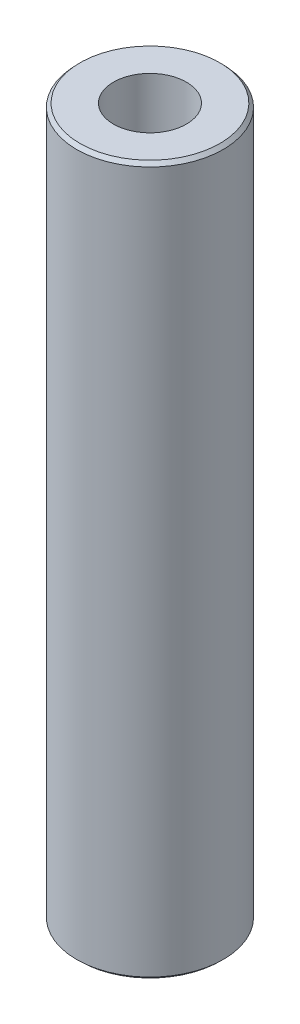
from build123d import *
from OCP.BRepFilletAPI import BRepFilletAPI_MakeChamfer

# Parameters (mm, degrees)
SKETCH1_R           = 60
BOSS_EXTRUDE1_DEPTH = 580.026093204
SKETCH2_R           = 29.843052905
CUT_EXTRUDE1_DEPTH  = 587.199853973
CHAMFER1_SIZE       = 2.90600484
CHAMFER1_SIZE2      = 2.715987347


with BuildPart() as part:
    # Sketch1 → Boss-Extrude1 (new body)
    with BuildSketch(Plane(origin=(0, 0, 0), x_dir=(1, 0, 0), z_dir=(0, 1, 0))):
        Circle(SKETCH1_R)
    extrude(amount=BOSS_EXTRUDE1_DEPTH)

    # Sketch2 → Cut-Extrude1 (cut, through all)
    with BuildSketch(Plane(origin=(0, 0, 0), x_dir=(1, 0, 0), z_dir=(0, 1, 0))):
        Circle(SKETCH2_R)
    extrude(amount=CUT_EXTRUDE1_DEPTH, mode=Mode.SUBTRACT)

    # Chamfer1: one chamfer whose edges measure the first distance from different faces: ONE call of the kernel's chamfer builder (chamfer() names one face for all edges)
    chamfer1_edges_1 = [part.edges().sort_by_distance(p)[0] for p in [
        (-60, 580.026093204, 0),
    ]]
    chamfer1_side_1 = [part.faces().sort_by_distance(p)[0] for p in [
        (-60, 290.013046602, 0),
    ]]
    chamfer1_edges_2 = [part.edges().sort_by_distance(p)[0] for p in [
        (-60, 0, 0),
    ]]
    chamfer1_side_2 = [part.faces().sort_by_distance(p)[0] for p in [
        (-58.302943725, 0, 0),
    ]]
    chamfer1 = BRepFilletAPI_MakeChamfer(part.part.solid().wrapped)
    for e in chamfer1_edges_1:
        chamfer1.Add(CHAMFER1_SIZE, CHAMFER1_SIZE2, e.wrapped, chamfer1_side_1[0].wrapped)  # the first distance lies on this face
    for e in chamfer1_edges_2:
        chamfer1.Add(CHAMFER1_SIZE, CHAMFER1_SIZE2, e.wrapped, chamfer1_side_2[0].wrapped)  # the first distance lies on this face
    add(Compound.cast(chamfer1.Shape()), mode=Mode.REPLACE)


solid = part.part
